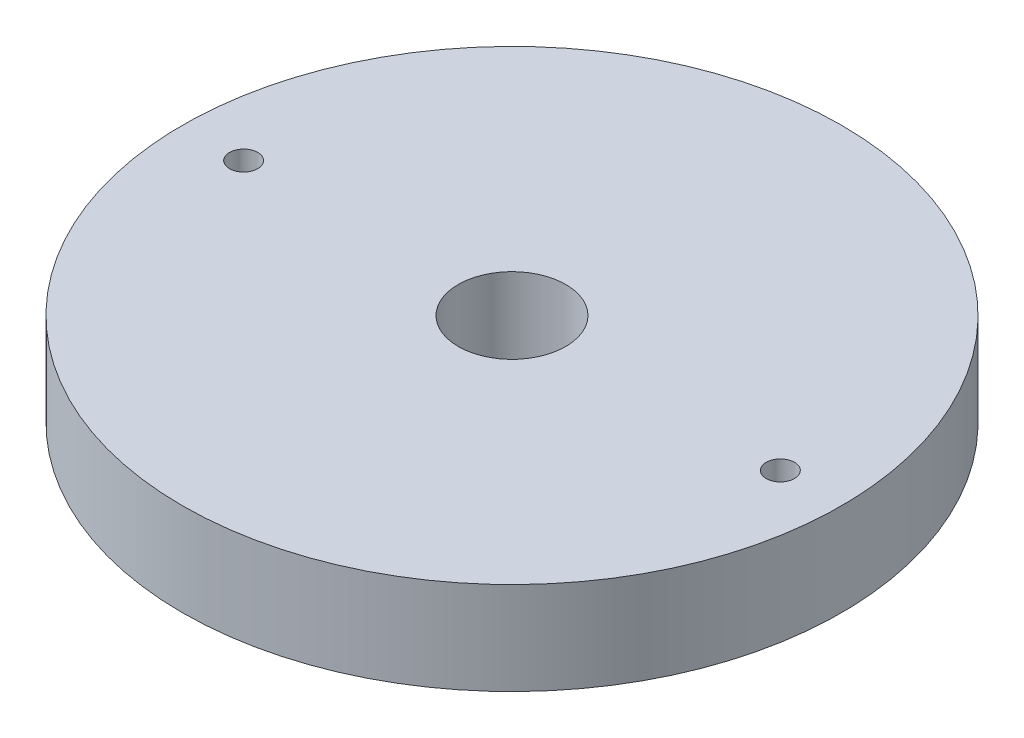
from build123d import *

# Parameters (mm, degrees)
SKETCH1_R            = 17.78
SKETCH1_R_2          = 0.762
BOSS_EXTRUDE1_DEPTH  = 5
SKETCH5_R            = 2.667
CUT_EXTRUDE1_DEPTH   = 3
M5_CLEARANCE_HOLE2_D = 5.8


with BuildPart() as part:
    # Sketch1 → Boss-Extrude1 (new body)
    with BuildSketch(Plane(origin=(0, 0, 0), x_dir=(1, 0, 0), z_dir=(0, 1, 0))):
        Circle(SKETCH1_R)
        with Locations((-14.478, 0)):
            Circle(SKETCH1_R_2, mode=Mode.SUBTRACT)
        with Locations((14.478, 0)):
            Circle(SKETCH1_R_2, mode=Mode.SUBTRACT)
    extrude(amount=BOSS_EXTRUDE1_DEPTH)

    # Sketch5 → Cut-Extrude1 (cut)
    with BuildSketch(Plane.XZ):
        with Locations((0, 13.97)):
            Circle(SKETCH5_R)
    extrude(amount=-CUT_EXTRUDE1_DEPTH, mode=Mode.SUBTRACT)

    # M5 Clearance Hole2 (through all)
    with Locations(Plane(origin=(0, 5, 0), x_dir=(1, 0, 0), z_dir=(0, 1, 0))):
        with Locations((0, 0)):
            Hole(M5_CLEARANCE_HOLE2_D / 2)


solid = part.part
